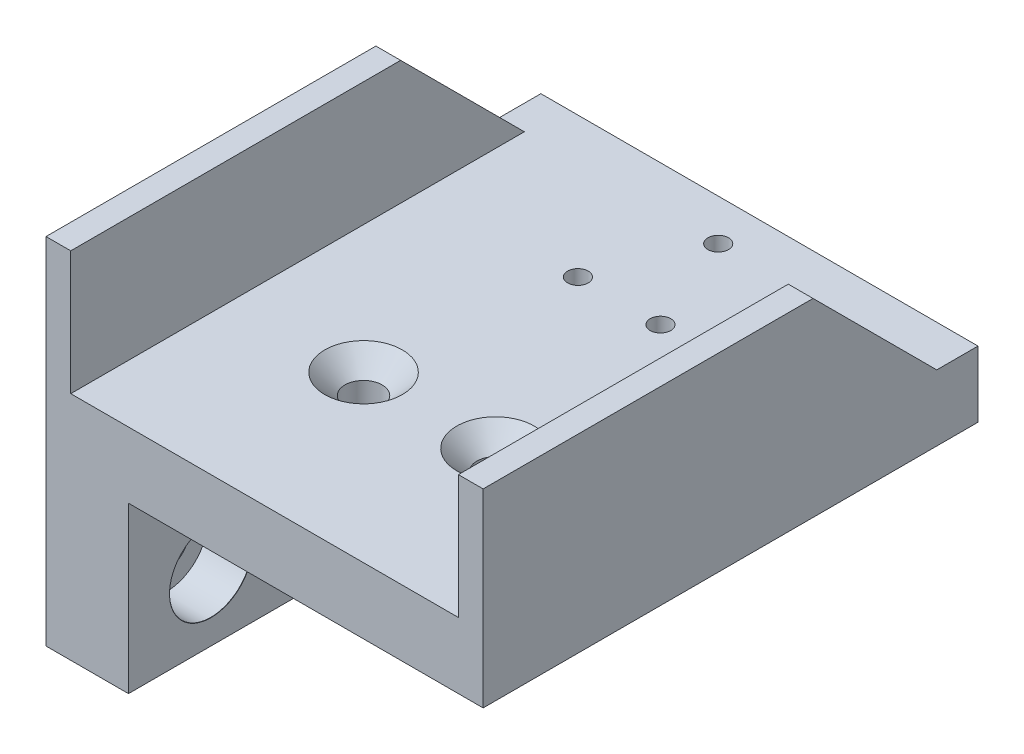
from build123d import *

# Parameters (mm, degrees)
BOSS_EXTRUDE1_DEPTH                                 = 20
SKETCH2_W                                           = 53
SKETCH2_H                                           = 20
BOSS_EXTRUDE2_DEPTH                                 = 8
SKETCH11_W                                          = 60
SKETCH11_H                                          = 20
BOSS_EXTRUDE3_DEPTH                                 = 10
M3_TAPPED_HOLE1_D                                   = 2.5
CSK_FOR_M4_COUNTERSUNK_FLAT_HEAD_SCREW1_D           = 4.5
CSK_FOR_M4_COUNTERSUNK_FLAT_HEAD_SCREW1_CSINK_D     = 9.4
CSK_FOR_M4_COUNTERSUNK_FLAT_HEAD_SCREW1_CSINK_ANGLE = 90
CHAMFER1_SIZE                                       = 15
CBORE_FOR_M5_HEX_SOCKET_HEAD_CAP_SCR_2_COUNT        = 2
CBORE_FOR_M5_HEX_SOCKET_HEAD_CAP_SCR_2_PITCH        = 20
CBORE_FOR_M5_HEX_SOCKET_HEAD_CAP_SCR_3_COUNT        = 2
CBORE_FOR_M5_HEX_SOCKET_HEAD_CAP_SCR_3_PITCH        = 40


with BuildPart() as part:
    # Sketch1 → Boss-Extrude1 (new, symmetric)
    with BuildSketch(Plane.XY):
        Polygon((-23.5, 11.5), (-23.5, -3.5), (23.5, -3.5), (23.5, 11.5), (26.5, 11.5), (26.5, -11.5), (-26.5, -11.5), (-26.5, 11.5), align=None)
    extrude(amount=BOSS_EXTRUDE1_DEPTH, both=True)

    # Sketch2 → Boss-Extrude2 (add)
    with BuildSketch(Plane(origin=(0, -3.5, 0), x_dir=(1, 0, 0), z_dir=(0, 1, 0))):
        with Locations((0, 30)):
            Rectangle(SKETCH2_W, SKETCH2_H)
    extrude(amount=-BOSS_EXTRUDE2_DEPTH)

    # Sketch11 → Boss-Extrude3 (add)
    with BuildSketch(Plane(origin=(-26.5, 0, 0), x_dir=(0, 0, -1), z_dir=(1, 0, 0))):
        with Locations((10, -21.5)):
            Rectangle(SKETCH11_W, SKETCH11_H)
    extrude(amount=BOSS_EXTRUDE3_DEPTH)

    # M3 Tapped Hole1 (through all)
    with Locations(Plane(origin=(0, -3.5, 0), x_dir=(1, 0, 0), z_dir=(0, 1, 0))):
        with Locations((0, 35), (-5, 23), (5, 23)):
            Hole(M3_TAPPED_HOLE1_D / 2)

    # CSK for M4 Countersunk Flat Head Screw1 (through all)
    with Locations(Plane(origin=(0, -3.5, 0), x_dir=(1, 0, 0), z_dir=(0, 1, 0))):
        with Locations((-8, 0), (8, 0)):
            CounterSinkHole(CSK_FOR_M4_COUNTERSUNK_FLAT_HEAD_SCREW1_D / 2, CSK_FOR_M4_COUNTERSUNK_FLAT_HEAD_SCREW1_CSINK_D / 2, counter_sink_angle=CSK_FOR_M4_COUNTERSUNK_FLAT_HEAD_SCREW1_CSINK_ANGLE)

    # Chamfer1
    chamfer1_edges = [part.edges().sort_by_distance(p)[0] for p in [
        (-25, -3.5, -20),
        (25, -3.5, -20),
    ]]
    chamfer(chamfer1_edges, length=CHAMFER1_SIZE - 0.0001)  # a hair under: the kernel refuses the full size

    # Sketch14 → CBORE for M5 Hex Socket Head Cap Screw1 (revolve, cut)
    with BuildSketch(Plane(origin=(-16.5, -23.5, -30), x_dir=(0, 0, -1), z_dir=(0, 1, 0))):
        Polygon((0, 0), (0, 10), (2.775, 10), (2.75, 9.975), (2.75, 5.4), (5, 5.4), (5, 0.025), (5.025, 0), align=None)
    cbore_for_m5_hex_socket_head_cap_screw1 = revolve(axis=Axis((-10.15, -23.5, -30), (-1, 0, 0)), mode=Mode.SUBTRACT)

    # CBORE for M5 Hex Socket Head Cap Scr 2: CBORE for M5 Hex Socket Head Cap Screw1 ×2
    with Locations(*[(0, 0, i * CBORE_FOR_M5_HEX_SOCKET_HEAD_CAP_SCR_2_PITCH) for i in range(1, CBORE_FOR_M5_HEX_SOCKET_HEAD_CAP_SCR_2_COUNT)]):
        add(cbore_for_m5_hex_socket_head_cap_screw1, mode=Mode.SUBTRACT)

    # CBORE for M5 Hex Socket Head Cap Scr 3: CBORE for M5 Hex Socket Head Cap Screw1 ×2
    with Locations(*[(0, 0, i * CBORE_FOR_M5_HEX_SOCKET_HEAD_CAP_SCR_3_PITCH) for i in range(1, CBORE_FOR_M5_HEX_SOCKET_HEAD_CAP_SCR_3_COUNT)]):
        add(cbore_for_m5_hex_socket_head_cap_screw1, mode=Mode.SUBTRACT)


solid = part.part
